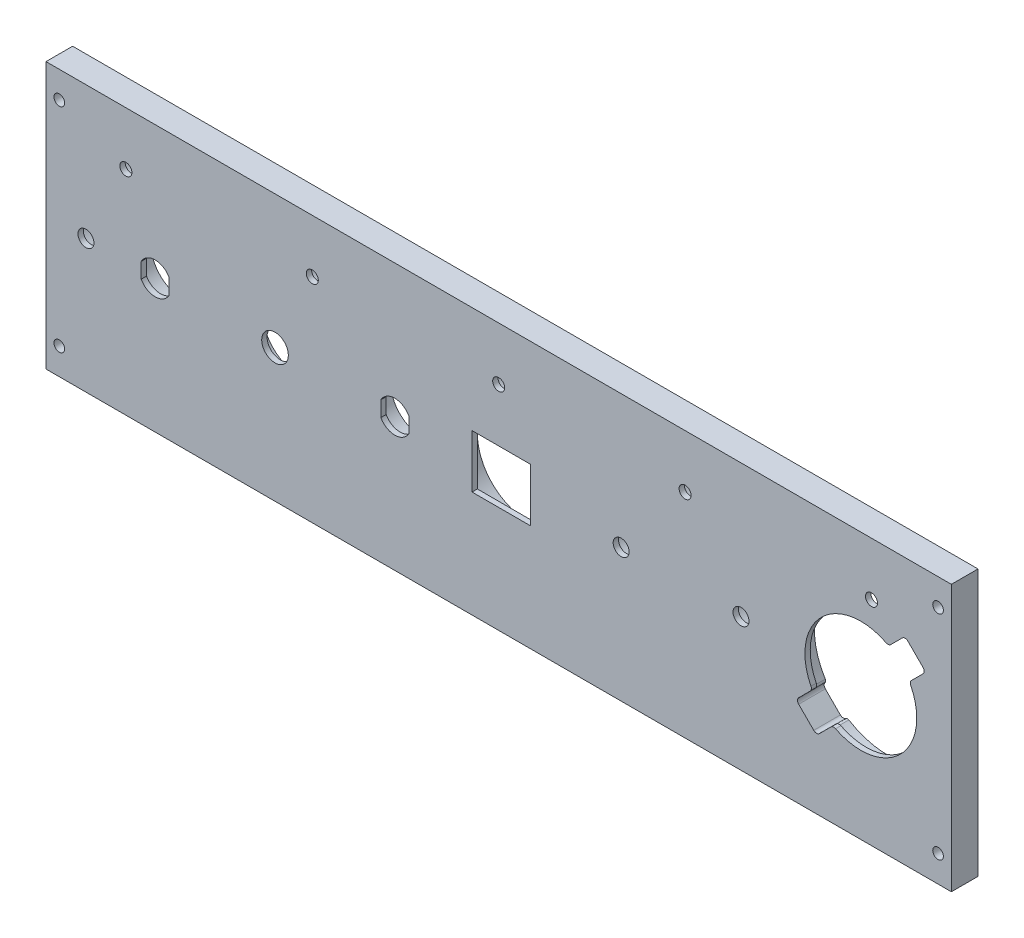
from build123d import *

# Parameters (mm, degrees)
ESQUISSE1_W                  = 340
ESQUISSE1_H                  = 100.00000000000001
BOSS_EXTRU_1_DEPTH           = 10
ENL_V_MAT_EXTRU_1_DEPTH      = 355.54195802471673
ENL_V_MAT_EXTRU_1_DEPTH_BACK = 355.54195802471673
ESQUISSE2_R                  = 3.0000000000000018
ESQUISSE2_R_2                = 6.0000000000000036
ESQUISSE2_R_3                = 5.000000000000005
ESQUISSE2_R_4                = 6.000000000000017
ESQUISSE2_R_5                = 2.9999999999999947
ESQUISSE2_R_6                = 21.000000000000014
ESQUISSE2_W                  = 22.00000000000003
ESQUISSE2_H                  = 20.000000000000007
ENL_V_MAT_EXTRU_2_DEPTH      = 355.54195802471673
ENL_V_MAT_EXTRU_2_DEPTH_BACK = 355.54195802471673
ESQUISSE3_R                  = 2.2500000000000093
ESQUISSE3_R_2                = 2.2499999999999964
ESQUISSE3_R_3                = 2.2500000000000027
ESQUISSE3_R_4                = 2.2500000000000138
ESQUISSE5_R                  = 27.500000000000032
ESQUISSE5_R_2                = 8.999999999999984
ESQUISSE5_R_3                = 7.5000000000000115
ESQUISSE5_R_4                = 18.99999999999999
ESQUISSE5_R_5                = 11.499999999999993
ESQUISSE5_R_6                = 14.999999999999998
ESQUISSE5_R_7                = 11.499999999999998
ESQUISSE5_R_8                = 10.5
ENL_V_MAT_EXTRU_3_DEPTH      = 8
ESQUISSE6_W                  = 5.2500000000000036
ESQUISSE6_H                  = 11.999999999999993
ESQUISSE6_W_2                = 5.250000000000007
ESQUISSE6_W_3                = 5.25
BOSS_EXTRU_2_DEPTH           = 2
ESQUISSE8_R                  = 2.0000000000000027
ESQUISSE8_R_2                = 2.0000000000000018
ESQUISSE8_R_3                = 1.9999999999999967
ENL_V_MAT_EXTRU_4_DEPTH      = 10
ESQUISSE9_R                  = 6.999999999999988
ESQUISSE9_R_2                = 7.000000000000015
ESQUISSE9_R_3                = 7.000000000000002
ENL_V_MAT_EXTRU_5_DEPTH      = 8
CONG_1_R                     = 2
ENL_V_MAT_EXTRU_6_DEPTH      = 355.49118478405074
ENL_V_MAT_EXTRU_6_DEPTH_BACK = 355.49118478405074
CONG_2_R                     = 1.5
CONG_3_R                     = 1


with BuildPart() as part:
    # Esquisse1 → Boss.-Extru.1 (new body)
    with BuildSketch(Plane.XY):
        with Locations((170, 50.00000000000001)):
            Rectangle(ESQUISSE1_W, ESQUISSE1_H)
    extrude(amount=BOSS_EXTRU_1_DEPTH)

    # Esquisse2 → Enlèv. mat.-Extru.1 (cut, two sides: drawn at the far end of the back side and taken through both)
    with BuildSketch(Plane.XY.offset(10).offset(-ENL_V_MAT_EXTRU_1_DEPTH_BACK)):
        with Locations((15.000000000000007, 50)):
            Circle(ESQUISSE2_R)
        with Locations((41.00000000000001, 49.99999999999999)):
            Circle(ESQUISSE2_R_2)
        with Locations((86, 49.99999999999999)):
            Circle(ESQUISSE2_R_3)
        with Locations((131, 50)):
            Circle(ESQUISSE2_R_4)
        with Locations((216.00000000000003, 50)):
            Circle(ESQUISSE2_R_5)
        with Locations((261, 50)):
            Circle(ESQUISSE2_R_5)
        with Locations((306, 50)):
            Circle(ESQUISSE2_R_6)
        with Locations((171, 50)):
            Rectangle(ESQUISSE2_W, ESQUISSE2_H)
    extrude(amount=ENL_V_MAT_EXTRU_1_DEPTH + ENL_V_MAT_EXTRU_1_DEPTH_BACK, mode=Mode.SUBTRACT)

    # Esquisse3 → Enlèv. mat.-Extru.2 (cut, two sides: drawn at the far end of the back side and taken through both)
    with BuildSketch(Plane.XY.offset(10).offset(-ENL_V_MAT_EXTRU_2_DEPTH_BACK)):
        with Locations((170, 80)):
            Circle(ESQUISSE3_R)
        with Locations((100, 80)):
            Circle(ESQUISSE3_R_2)
        with Locations((30, 80)):
            Circle(ESQUISSE3_R_3)
        with Locations(Location((310.00000000000006, 80, 0), (0, 0, 180))):
            Circle(ESQUISSE3_R_4)
        with Locations(Location((240.00000000000003, 80, 0), (0, 0, 180))):
            Circle(ESQUISSE3_R)
    extrude(amount=ENL_V_MAT_EXTRU_2_DEPTH + ENL_V_MAT_EXTRU_2_DEPTH_BACK, mode=Mode.SUBTRACT)

    # Esquisse5 → Enlèv. mat.-Extru.3 (cut)
    with BuildSketch(Plane(origin=(0, 0, 0), x_dir=(-1, 0, 0), z_dir=(0, 0, -1))):
        with Locations((-306, 50)):
            Circle(ESQUISSE5_R)
        with Locations((-261, 50)):
            Circle(ESQUISSE5_R_2)
        with Locations((-216.00000000000003, 50)):
            Circle(ESQUISSE5_R_3)
        with Locations((-171, 50)):
            Circle(ESQUISSE5_R_4)
        with Locations((-131, 50)):
            Circle(ESQUISSE5_R_5)
        with Locations((-86, 49.99999999999999)):
            Circle(ESQUISSE5_R_6)
        with Locations((-41.00000000000001, 49.99999999999999)):
            Circle(ESQUISSE5_R_7)
        with Locations((-15.000000000000007, 50)):
            Circle(ESQUISSE5_R_8)
    extrude(amount=-ENL_V_MAT_EXTRU_3_DEPTH, mode=Mode.SUBTRACT)

    # Esquisse6 → Boss.-Extru.2 (add)
    with BuildSketch(Plane.XY.offset(10)):
        with Locations((33.12500000000001, 50)):
            Rectangle(ESQUISSE6_W, ESQUISSE6_H)
        with Locations((48.875000000000014, 50)):
            Rectangle(ESQUISSE6_W_2, ESQUISSE6_H)
        with Locations((123.12499999999997, 50)):
            Rectangle(ESQUISSE6_W_3, ESQUISSE6_H)
        with Locations((138.87500000000003, 50)):
            Rectangle(ESQUISSE6_W_3, ESQUISSE6_H)
    extrude(amount=-BOSS_EXTRU_2_DEPTH)

    # Esquisse8 → Enlèv. mat.-Extru.4 (cut)
    with BuildSketch(Plane.XY.offset(10)):
        with Locations((5, 90)):
            Circle(ESQUISSE8_R)
        with Locations(Location((5.00000000000001, 10.000000000000009, 0), (0, 0, 180))):
            Circle(ESQUISSE8_R_2)
        with Locations((335, 10.000000000000009)):
            Circle(ESQUISSE8_R_3)
        with Locations(Location((335, 90, 0), (0, 0, 180))):
            Circle(ESQUISSE8_R_3)
    extrude(amount=-ENL_V_MAT_EXTRU_4_DEPTH, mode=Mode.SUBTRACT)

    # Esquisse9 → Enlèv. mat.-Extru.5 (cut)
    with BuildSketch(Plane(origin=(0, 0, 0), x_dir=(-1, 0, 0), z_dir=(0, 0, -1))):
        with Locations((-310.00000000000006, 80)):
            Circle(ESQUISSE9_R)
        with Locations((-240.00000000000003, 80)):
            Circle(ESQUISSE9_R_2)
        with Locations((-170, 80)):
            Circle(ESQUISSE9_R_2)
        with Locations((-100, 80)):
            Circle(ESQUISSE9_R_3)
        with Locations((-30, 80)):
            Circle(ESQUISSE9_R_3)
    extrude(amount=-ENL_V_MAT_EXTRU_5_DEPTH, mode=Mode.SUBTRACT)

    # Congé1
    cong_1_edges = [part.edges().sort_by_distance(p)[0] for p in [
        (303.5061116987467, 77.38668510683382, 4),
        (315.5823162488517, 75.77652450015313, 4),
    ]]
    fillet(cong_1_edges, radius=CONG_1_R)

    # Esquisse10 → Enlèv. mat.-Extru.6 (cut, two sides: drawn at the far end of the back side and taken through both)
    with BuildSketch(Plane(origin=(0, 0, 8), x_dir=(-1, 0, 0), z_dir=(0, 0, -1)).offset(-ENL_V_MAT_EXTRU_6_DEPTH_BACK)):
        Polygon((-314.13172798364525, 65.90990257669736), (-321.90990257669733, 58.13172798364529), (-330.39518395093586, 66.61700935788389), (-322.6170093578838, 74.39518395093592), align=None)
        Polygon((-290.09009742330267, 41.8682720163547), (-281.60481604906414, 33.382990642116134), (-289.3829906421162, 25.60481604906408), (-297.86827201635475, 34.09009742330265), align=None)
    extrude(amount=ENL_V_MAT_EXTRU_6_DEPTH + ENL_V_MAT_EXTRU_6_DEPTH_BACK, mode=Mode.SUBTRACT)

    # Congé2
    cong_2_edges = [part.edges().sort_by_distance(p)[0] for p in [
        (281.60481604906414, 33.382990642116134, 5),
        (295.55817664855954, 31.780002055507403, 9),
        (289.3829906421162, 25.60481604906408, 5),
        (287.78000205550745, 39.55817664855947, 9),
        (330.39518395093586, 66.61700935788389, 5),
        (324.21999794449255, 60.44182335144051, 9),
        (316.44182335144046, 68.21999794449256, 9),
        (322.6170093578838, 74.39518395093592, 5),
    ]]
    fillet(cong_2_edges, radius=CONG_2_R)

    # Congé3
    # the kernel refuses this fillet: 1 mm, written as the material it takes off along each edge
    with BuildSketch(Plane(origin=(328.9416461797837, 65.16347158673169, 8), x_dir=(0.5395485077638712, -0.8419545164495408, 0), z_dir=(0, 0, -1))) as cong_3_piece_1:
        with BuildLine():
            CenterArc((0.7917838484009534, -0.9999000393817246), CONG_3_R, 90.81013186536997, 71.06099512229089)
            Line((-0.15857520364130714, -0.688744656652602), (-0.2536111088455419, -0.6576291183796682))
            ThreePointArc((-0.2536111088455419, -0.6576291183796682), (-0.216495562393325, -0.5213782577373202), (-0.09768701566509973, 0.02138333394130856))
            Line((-0.09768701566509973, 0.02138333394130856), (0.00141389972929694, 0.09999000393815428))
            ThreePointArc((0.00141389972929694, 0.09999000393815428), (0.3888224255540418, 0.09725108299714401), (0.7762309513787835, 0.09999000393816994))
            Line((0.7762309513787835, 0.09999000393816994), (0.7776448511080656, -5e-17))
        make_face()
    extrude(amount=9.944112127770163, mode=Mode.SUBTRACT)
    with BuildSketch(Plane(origin=(321.1634715867316, 72.94164617978372, 8), x_dir=(0.7147000811371469, 0.6994310502276516, 0), z_dir=(0, 0, -1))) as cong_3_piece_2:
        with BuildLine():
            CenterArc((0.7967561378121499, -0.9959424723360712), CONG_3_R, 95.16315700004625, 71.0609951222958)
            Line((-0.17447860578954866, -0.7578184021101204), (-0.27160208014971443, -0.7340059950875214))
            ThreePointArc((-0.27160208014971443, -0.7340059950875214), (-0.18201092031799704, -0.35708917183648514), (-0.09775794201756788, 0.02105670374221132))
            Line((-0.09775794201756788, 0.02105670374221132), (0.00107968352981501, 0.09999417124750024))
            ThreePointArc((0.00107968352981501, 0.09999417124750024), (0.5566601276180686, 0.093995311039016), (0.6977647438705182, 0.09959424723359925))
            Line((0.6977647438705182, 0.09959424723359925), (0.7067639615015904, -4e-17))
        make_face()
    extrude(amount=9.94411212777035, mode=Mode.SUBTRACT)
    with BuildSketch(Plane(origin=(283.0583538202163, 34.836528413268304, 8), x_dir=(-0.6994310502276408, -0.7147000811371573, 0), z_dir=(0, 0, -1))) as cong_3_piece_3:
        with BuildLine():
            CenterArc((0.7967561378121149, 0.9959424723360829), CONG_3_R, 193.7758478776647, 71.06099512228826)
            Line((-0.17447860578955895, 0.7578184021100173), (-0.27160208014972437, 0.7340059950874168))
            ThreePointArc((-0.27160208014972437, 0.7340059950874168), (-0.18201092031802182, 0.3570891718364219), (-0.09775794201756777, -0.02105670374219269))
            Line((-0.09775794201756777, -0.02105670374219269), (0.00107968352983153, -0.09999417124749502))
            ThreePointArc((0.00107968352983153, -0.09999417124749502), (0.5566601276181505, -0.09399531103902689), (0.6977647438704697, -0.09959424723361945))
            Line((0.6977647438704697, -0.09959424723361945), (0.7067639615015402, 5e-17))
        make_face()
    extrude(amount=9.944112127770104, mode=Mode.SUBTRACT)
    with BuildSketch(Plane(origin=(290.8365284132684, 27.05835382021624, 8), x_dir=(-0.7147000811371251, -0.6994310502276738, 0), z_dir=(0, 0, -1))) as cong_3_piece_4:
        with BuildLine():
            CenterArc((0.7967561378121253, -0.9959424723360709), CONG_3_R, 95.16315700004816, 71.0609951222958)
            Line((-0.17447860578957813, -0.7578184021101529), (-0.27160208014974474, -0.7340059950875569))
            ThreePointArc((-0.27160208014974474, -0.7340059950875569), (-0.18201092031804894, -0.35708917183650773), (-0.0977579420175735, 0.02105670374221336))
            Line((-0.0977579420175735, 0.02105670374221336), (0.00107968352981438, 0.09999417124749772))
            ThreePointArc((0.00107968352981438, 0.09999417124749772), (0.5566601276180955, 0.09399531103900281), (0.6977647438704596, 0.0995942472335964))
            Line((0.6977647438704596, 0.0995942472335964), (0.7067639615015323, -4e-17))
        make_face()
    extrude(amount=9.944112127770445, mode=Mode.SUBTRACT)


solid = part.part
